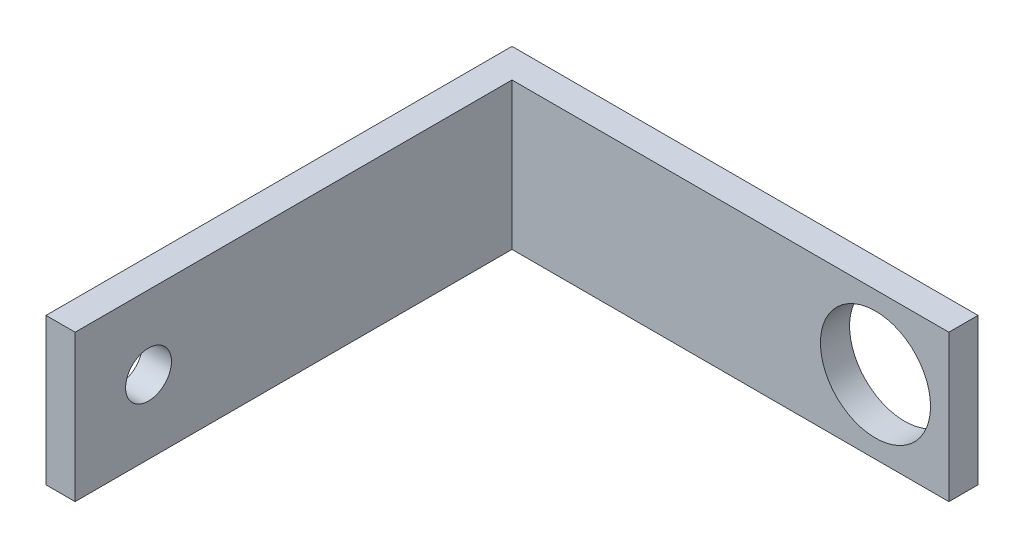
from build123d import *

# Parameters (mm, degrees)
BOSS_EXTRUDE1_DEPTH = 4
SKETCH2_R           = 1.25
CUT_EXTRUDE1_DEPTH  = 33.264456547
SKETCH3_R           = 3
CUT_EXTRUDE2_DEPTH  = 33.264456547


with BuildPart() as part:
    # Sketch1 → Boss-Extrude1 (new, symmetric)
    with BuildSketch(Plane(origin=(0, 0, 0), x_dir=(1, 0, 0), z_dir=(0, 1, 0))):
        Polygon((-19.8125, 19.8125), (-4, 19.8125), (4, 19.8125), (4, 21.4), (-4, 21.4), (-21.4, 21.4), (-21.4, 4), (-21.4, -4), (-19.8125, -4), (-19.8125, 4), align=None)
    extrude(amount=BOSS_EXTRUDE1_DEPTH, both=True)

    # Sketch2 → Cut-Extrude1 (cut, through all)
    with BuildSketch(Plane(origin=(-19.8125, 0, 0), x_dir=(0, 0, -1), z_dir=(1, 0, 0))):
        Circle(SKETCH2_R)
    extrude(amount=-CUT_EXTRUDE1_DEPTH, mode=Mode.SUBTRACT)

    # Sketch3 → Cut-Extrude2 (cut, through all)
    with BuildSketch(Plane.XY.offset(-19.8125)):
        Circle(SKETCH3_R)
    extrude(amount=-CUT_EXTRUDE2_DEPTH, mode=Mode.SUBTRACT)


solid = part.part
